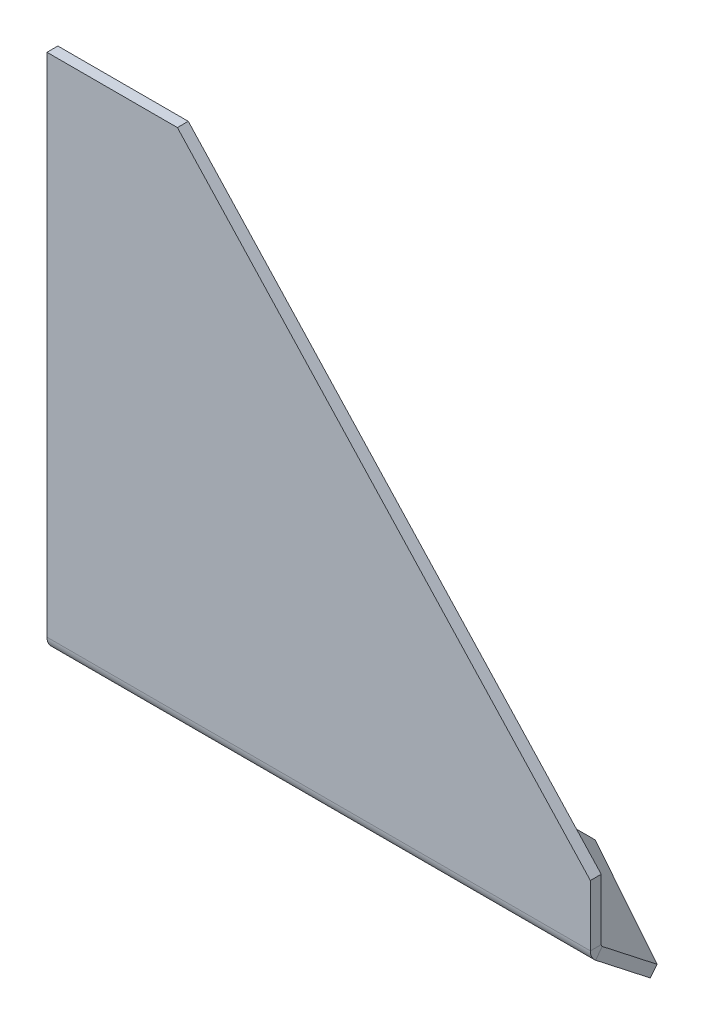
from build123d import *

# Parameters (mm, degrees)
BASE_FLANGE1_DEPTH   = 10
EDGE_FLANGE1_START   = -322.556390977
EDGE_FLANGE1_DEPTH   = 500
EDGE_FLANGE1_2_DEPTH = 500
CUT_EXTRUDE1_DEPTH   = 10


# Read off the part's stored shape, not the designer's step: Edge-Flange1
# Sheet-metal steps are written as plain solids
with BuildPart() as part:
    # Sketch1 → Base-Flange1 (new body)
    with BuildSketch(Plane.XY):
        Polygon((-322.556390977, 364.661654135), (-202.556390977, 364.661654135), (177.443609023, -45.338345865), (177.443609023, -115.338345865), (-322.556390977, -115.338345865), align=None)
    extrude(amount=-BASE_FLANGE1_DEPTH)

    # Edge-Flange1 outline → Edge-Flange1 (cut)
    with BuildSketch(Plane.YZ.offset(EDGE_FLANGE1_START)):
        with BuildLine():
            Line((-115.338345865, -10), (-111.278966663, -4.804231558))
            ThreePointArc((-111.278966663, -4.804231558), (-106.908471578, -1.265074421), (-101.428832243, 0))
            Line((-101.428832243, 0), (-115.338345865, 0))
            Line((-115.338345865, 0), (-115.338345865, -10))
        make_face()
    extrude(amount=EDGE_FLANGE1_DEPTH, mode=Mode.SUBTRACT)

    # Edge-Flange1 2 outline → Edge-Flange1 2 (add)
    with BuildSketch(Plane.YZ.offset(EDGE_FLANGE1_START)):
        with BuildLine():
            Line((-101.428832243, -10), (-115.338345865, -10))
            Line((-115.338345865, -10), (-403.042997756, -378.245161731))
            Line((-403.042997756, -378.245161731), (-395.16289022, -384.401776484))
            Line((-395.16289022, -384.401776484), (-103.398859127, -10.960846312))
            ThreePointArc((-103.398859127, -10.960846312), (-102.52476011, -10.253014884), (-101.428832243, -10))
        make_face()
    extrude(amount=EDGE_FLANGE1_2_DEPTH)

    # Sketch9 → Cut-Extrude1 (cut)
    with BuildSketch(Plane(origin=(0, -66.769129934, 52.165761512), x_dir=(1, 0, 0), z_dir=(0, -0.788010753606719, 0.6156614753256621))):
        Polygon((-202.556390977, -546.199301562), (177.443609023, -136.199301562), (177.443609023, -546.199301562), align=None)
    extrude(amount=-CUT_EXTRUDE1_DEPTH, mode=Mode.SUBTRACT)


solid = part.part
